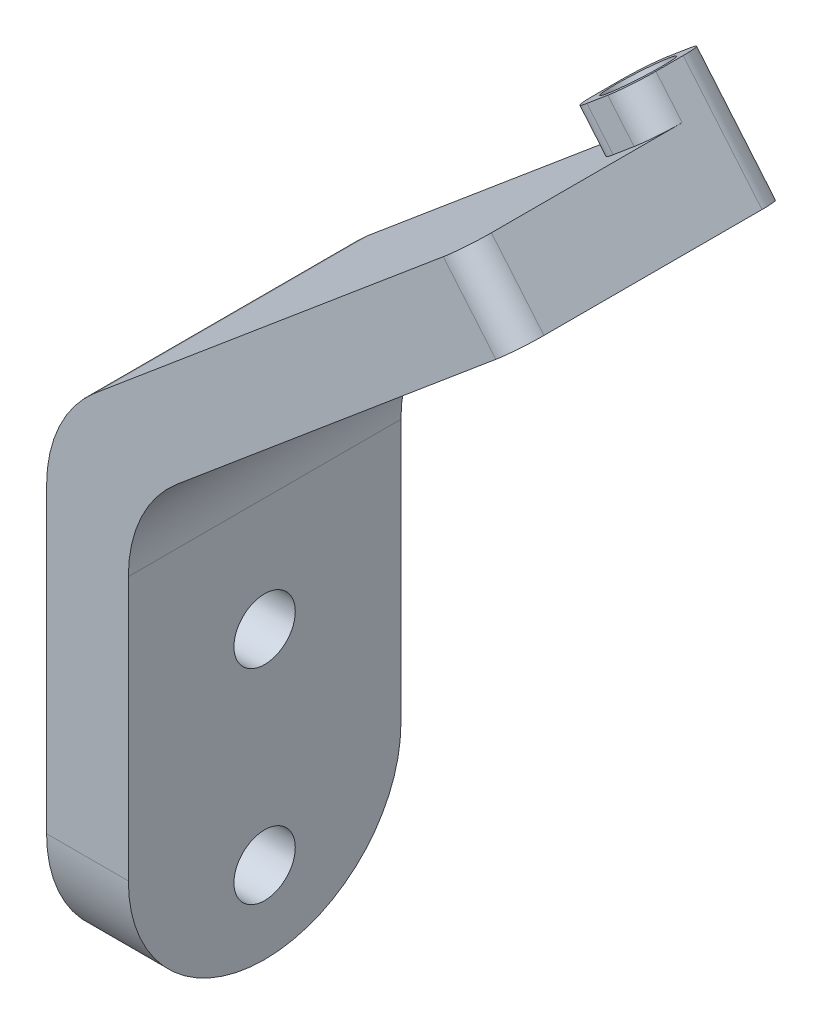
from build123d import *

# Parameters (mm, degrees)
BOSS_EXTRU_1_DEPTH           = 20
ENL_V_MAT_EXTRU_1_DEPTH      = 72.5512653594726
ENL_V_MAT_EXTRU_1_DEPTH_BACK = 72.5512653594726
ESQUISSE2_R                  = 2.250000000000001
ESQUISSE2_R_2                = 2.2500000000000027
ESQUISSE3_W                  = 6
ESQUISSE3_H                  = 6
BOSS_EXTRU_2_DEPTH           = 3
ESQUISSE4_R                  = 2.249999999999996
ENL_V_MAT_EXTRU_2_DEPTH      = 5
ENL_V_MAT_EXTRU_3_DEPTH      = 71.97314065505222
ENL_V_MAT_EXTRU_3_DEPTH_BACK = 71.97314065505222
ESQUISSE5_R                  = 1.7499999999999962
CONG_1_R                     = 10
CONG_2_R                     = 2


with BuildPart() as part:
    # Esquisse1 → Boss.-Extru.1 (new body)
    with BuildSketch(Plane.XY):
        Polygon((0, 0), (0, 36.797845948930004), (30.64177772475918, 62.50935033639152), (34.498503382878404, 57.91308367767763), (5.9999999999999964, 34), (6, -9.3e-16), align=None)
    extrude(amount=BOSS_EXTRU_1_DEPTH)

    # Esquisse2 → Enlèv. mat.-Extru.1 (cut, two sides: drawn at the far end of the back side and taken through both)
    with BuildSketch(Plane(origin=(6, 6.1e-16, 0), x_dir=(0, 0, -1), z_dir=(1, 1.2e-16, 0)).offset(-ENL_V_MAT_EXTRU_1_DEPTH_BACK)):
        with Locations(Location((-10, 6.000000000000001, 0), (0, 0, 90))):
            Circle(ESQUISSE2_R)
        with Locations(Location((-10, 21, 0), (0, 0, 90))):
            Circle(ESQUISSE2_R_2)
    extrude(amount=ENL_V_MAT_EXTRU_1_DEPTH + ENL_V_MAT_EXTRU_1_DEPTH_BACK, mode=Mode.SUBTRACT)

    # Esquisse3 → Boss.-Extru.2 (add)
    with BuildSketch(Plane(origin=(-18.11940199232756, 21.59386242001515, 0), x_dir=(0.7660444431189798, 0.6427876096865373, 0), z_dir=(-0.6427876096865373, 0.7660444431189798, 0))):
        with Locations((60.65319943912616, -3)):
            Rectangle(ESQUISSE3_W, ESQUISSE3_H)
    extrude(amount=BOSS_EXTRU_2_DEPTH)

    # Esquisse4 → Enlèv. mat.-Extru.2 (cut)
    with BuildSketch(Plane(origin=(-20.047764821387148, 23.89199574937203, 0), x_dir=(0.7660444431189795, 0.6427876096865378, 0), z_dir=(-0.6427876096865378, 0.7660444431189795, 0))):
        with Locations(Location((60.653199439126226, -3, 0), (0, 0, 180))):
            Circle(ESQUISSE4_R)
    extrude(amount=-ENL_V_MAT_EXTRU_2_DEPTH, mode=Mode.SUBTRACT)

    # Esquisse5 → Enlèv. mat.-Extru.3 (cut, two sides: drawn at the far end of the back side and taken through both)
    with BuildSketch(Plane(origin=(-16.83382677295446, 20.061773533777156, 0), x_dir=(0.7660444431189792, 0.6427876096865379, 0), z_dir=(-0.6427876096865379, 0.7660444431189792, 0)).offset(-ENL_V_MAT_EXTRU_3_DEPTH_BACK)):
        with Locations(Location((60.653199439126226, -3, 0), (0, 0, 180))):
            Circle(ESQUISSE5_R)
    extrude(amount=ENL_V_MAT_EXTRU_3_DEPTH + ENL_V_MAT_EXTRU_3_DEPTH_BACK, mode=Mode.SUBTRACT)

    # Congé1
    cong_1_edges = [part.edges().sort_by_distance(p)[0] for p in [
        (5.9999999999999964, 34, 10),
        (0, 36.797845948930004, 10),
        (3, -4.7e-16, 0),
        (3, -4.7e-16, 20),
    ]]
    fillet(cong_1_edges, radius=CONG_1_R - 0.0001)  # a hair under: the kernel refuses the full size

    # Congé2
    cong_2_edges = [part.edges().sort_by_distance(p)[0] for p in [
        (32.57014055381879, 60.21121700703458, 20),
        (29.67759631022939, 63.658417001069964, 6),
        (25.081329651515517, 59.80169134295074, 0),
        (25.081329651515517, 59.80169134295074, 6.000000000000001),
        (31.60595913928899, 61.360283671713034, 0),
    ]]
    fillet(cong_2_edges, radius=CONG_2_R)


solid = part.part
